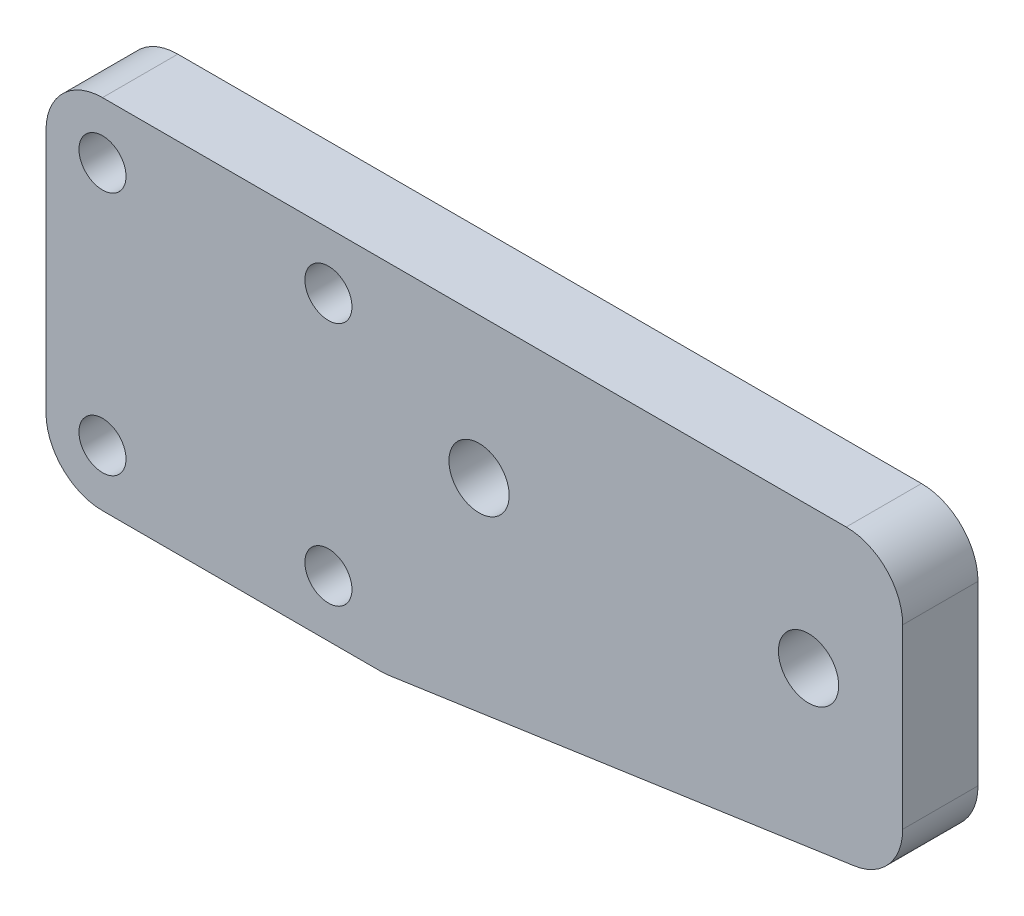
from build123d import *

# Parameters (mm, degrees)
ESBO_O1_R                = 1.25
ESBO_O1_R_2              = 1.6
RESSALTO_EXTRUS_O1_DEPTH = 4
FILETE1_R                = 3


with BuildPart() as part:
    # Esboço1 → Ressalto-extrusão1 (new body)
    with BuildSketch(Plane.XY):
        Polygon((-9, 9.5), (9, 9.5), (36.5, 9.5), (36.5, -5.5), (9, -9.5), (-9, -9.5), align=None)
        with Locations((6, -6.5)):
            Circle(ESBO_O1_R, mode=Mode.SUBTRACT)
        with Locations((6, 6.5)):
            Circle(ESBO_O1_R, mode=Mode.SUBTRACT)
        with Locations((-6, -6.5)):
            Circle(ESBO_O1_R, mode=Mode.SUBTRACT)
        with Locations((-6, 6.5)):
            Circle(ESBO_O1_R, mode=Mode.SUBTRACT)
        with Locations((31.5, 2)):
            Circle(ESBO_O1_R_2, mode=Mode.SUBTRACT)
        with Locations((14, 2)):
            Circle(ESBO_O1_R_2, mode=Mode.SUBTRACT)
    extrude(amount=RESSALTO_EXTRUS_O1_DEPTH)

    # Filete1
    filete1_edges = [part.edges().sort_by_distance(p)[0] for p in [
        (9, -9.5, 2),
        (36.5, -5.5, 2),
        (36.5, 9.5, 2),
        (-9, -9.5, 2),
        (-9, 9.5, 2),
    ]]
    fillet(filete1_edges, radius=FILETE1_R)


solid = part.part
